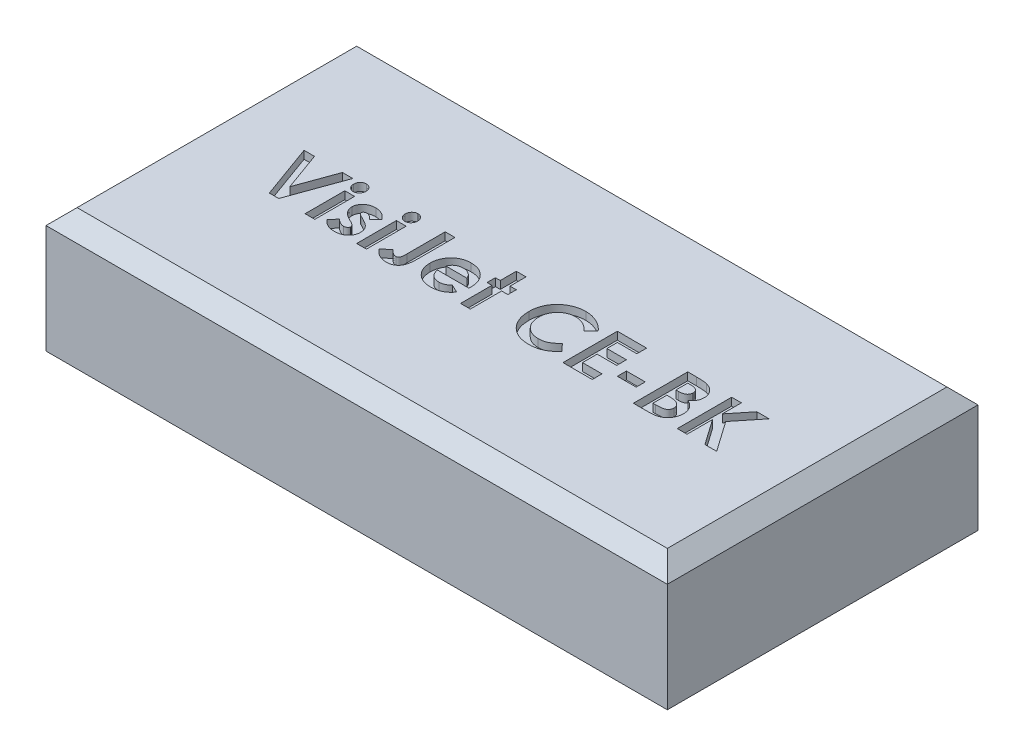
from build123d import *

# Parameters (mm, degrees)
SKETCH1_W           = 40
SKETCH1_H           = 20
BOSS_EXTRUDE1_DEPTH = 8
CHAMFER1_SIZE       = 1
SKETCH4_W           = 0.628205129
SKETCH4_H           = 2.557692308
SKETCH4_W_2         = 0.628205128
SKETCH4_W_3         = 1.211538461
SKETCH4_H_2         = 0.583333333
CUT_EXTRUDE3_DEPTH  = 0.5


with BuildPart() as part:
    # Sketch1 → Boss-Extrude1 (new body)
    with BuildSketch(Plane(origin=(0, 0, 0), x_dir=(1, 0, 0), z_dir=(0, 1, 0))):
        with Locations((0, 2.318501171)):
            Rectangle(SKETCH1_W, SKETCH1_H)
    extrude(amount=BOSS_EXTRUDE1_DEPTH)

    # Chamfer1
    chamfer1_edges = [part.edges().sort_by_distance(p)[0] for p in [
        (0, 8, 7.681498829),
        (-20, 8, -2.318501171),
        (0, 8, -12.318501171),
        (20, 8, -2.318501171),
    ]]
    chamfer(chamfer1_edges, length=CHAMFER1_SIZE)

    # Sketch4 → Cut-Extrude3 (cut)
    # profile 1 of 14: a face of its own
    with BuildSketch(Plane(origin=(0, 8, 0), x_dir=(1, 0, 0), z_dir=(0, 1, 0))):
        Polygon((-14.887820513, 3.818501171), (-14.216846955, 3.818501171), (-13.317307692, 1.332323286), (-12.415665064, 3.818501171), (-11.746794872, 3.818501171), (-13.015825321, 0.318501171), (-13.620893429, 0.318501171), align=None)
    # profile 2 of 14: a face of its own
    with BuildSketch(Plane(origin=(0, 8, 0), x_dir=(1, 0, 0), z_dir=(0, 1, 0))):
        with BuildLine():
            add(Edge.make_bspline(
                [(-11.0078125, 3.953116556), (-10.980736863, 3.951788122), (-10.927571242, 3.949179616), (-10.851404255, 3.923752479), (-10.781498398, 3.883845348), (-10.719699681, 3.829091813), (-10.668301287, 3.763706077), (-10.629031005, 3.690502399), (-10.607155167, 3.609395081), (-10.604116937, 3.553366994), (-10.602564103, 3.524731139)],
                knots=[0, 0, 0, 0, 0.989868614, 1.943702388, 2.910836514, 3.924849579, 4.949916355, 5.946401046, 6.950409252, 8, 8, 8, 8], degree=3))
            add(Edge.make_bspline(
                [(-10.602564103, 3.524731139), (-10.604061379, 3.496306314), (-10.606978893, 3.440919191), (-10.629534491, 3.360912942), (-10.6672286, 3.287744819), (-10.719043289, 3.223330183), (-10.780172027, 3.169458486), (-10.848550388, 3.128826865), (-10.923987474, 3.104814234), (-10.976328126, 3.101987671), (-11.002904647, 3.100552453)],
                knots=[0, 0, 0, 0, 1.05296456, 2.051751585, 3.055639087, 4.085634717, 5.099016424, 6.062201612, 7.016062274, 8, 8, 8, 8], degree=3))
            add(Edge.make_bspline(
                [(-11.002904647, 3.100552453), (-11.030216632, 3.101876137), (-11.083844792, 3.104475244), (-11.160636505, 3.129961874), (-11.231474728, 3.169554711), (-11.293005362, 3.225426946), (-11.344992383, 3.291277296), (-11.382547323, 3.36618522), (-11.406038867, 3.447847148), (-11.408827293, 3.504705048), (-11.41025641, 3.533845722)],
                knots=[0, 0, 0, 0, 0.989065327, 1.942068821, 2.907541208, 3.917690034, 4.939857478, 5.938239964, 6.943311734, 8, 8, 8, 8], degree=3))
            add(Edge.make_bspline(
                [(-11.41025641, 3.533845722), (-11.40870114, 3.561787876), (-11.405646036, 3.616676204), (-11.383639159, 3.695980268), (-11.345269344, 3.767953278), (-11.294241178, 3.832142067), (-11.232985262, 3.885874243), (-11.163121369, 3.924569368), (-11.087466989, 3.948946292), (-11.034638153, 3.951712114), (-11.0078125, 3.953116556)],
                knots=[0, 0, 0, 0, 1.038616768, 2.040212704, 3.031499824, 4.052181184, 5.074969369, 6.039807101, 7.004644834, 8, 8, 8, 8], degree=3))
        make_face()
    # profile 3 of 14: a face of its own
    with BuildSketch(Plane(origin=(0, 8, 0), x_dir=(1, 0, 0), z_dir=(0, 1, 0))):
        with Locations((-11.006410257, 1.597347325)):
            Rectangle(SKETCH4_W, SKETCH4_H)
    # profile 4 of 14: a face of its own
    with BuildSketch(Plane(origin=(0, 8, 0), x_dir=(1, 0, 0), z_dir=(0, 1, 0))):
        with BuildLine():
            Line((-8.538461538, 2.481461908), (-8.922676282, 2.068501171))
            add(Edge.make_bspline(
                [(-8.922676282, 2.068501171), (-8.941861965, 2.089731169), (-8.978556908, 2.130336114), (-9.03473332, 2.185689728), (-9.090073156, 2.231782937), (-9.143545162, 2.270503154), (-9.196241427, 2.300196932), (-9.247723927, 2.32156094), (-9.298017364, 2.33512313), (-9.33135398, 2.336878704), (-9.34755609, 2.33773194)],
                knots=[0, 0, 0, 0, 1.327646587, 2.539285, 3.655602211, 4.666613517, 5.598770349, 6.454635452, 7.248928967, 8, 8, 8, 8], degree=3))
            add(Edge.make_bspline(
                [(-9.34755609, 2.33773194), (-9.363950998, 2.33723228), (-9.395342146, 2.336275585), (-9.439642091, 2.328069544), (-9.478562556, 2.313863375), (-9.511496163, 2.294499043), (-9.537955605, 2.270644174), (-9.556481095, 2.243354767), (-9.568921132, 2.213479587), (-9.569973478, 2.192258092), (-9.570512821, 2.18138178)],
                knots=[0, 0, 0, 0, 1.295068245, 2.479652818, 3.543291146, 4.55379989, 5.481948265, 6.332409746, 7.145336708, 8, 8, 8, 8], degree=3))
            add(Edge.make_bspline(
                [(-9.570512821, 2.18138178), (-9.568685479, 2.164899466), (-9.564893959, 2.130700579), (-9.53885147, 2.091034972), (-9.504395376, 2.061774466), (-9.464677463, 2.034545884), (-9.410889127, 2.004101415), (-9.37008393, 1.983255198), (-9.34755609, 1.971746363)],
                knots=[0, 0, 0, 0, 0.916701701, 1.902049539, 2.5493345, 3.440293453, 4.586830489, 6, 6, 6, 6], degree=3))
            Line((-9.34755609, 1.971746363), (-9.120392628, 1.856762389))
            add(Edge.make_bspline(
                [(-9.120392628, 1.856762389), (-9.091493092, 1.842088143), (-9.035422565, 1.813617351), (-8.956592655, 1.767675903), (-8.883784094, 1.723146153), (-8.818457399, 1.677509175), (-8.76021273, 1.631557834), (-8.709463796, 1.584837732), (-8.664979678, 1.538829986), (-8.615373643, 1.477146177), (-8.56575272, 1.394988362), (-8.524384281, 1.288145952), (-8.498004131, 1.173741222), (-8.495085471, 1.094557347), (-8.493589744, 1.053977934)],
                knots=[0, 0, 0, 0, 1.076693506, 2.088987655, 3.030641824, 3.911722491, 4.735175175, 5.493635918, 6.202154166, 6.859459289, 8.120623445, 9.372284821, 10.653373066, 12, 12, 12, 12], degree=3))
            add(Edge.make_bspline(
                [(-8.493589744, 1.053977934), (-8.494490929, 1.026601336), (-8.496254788, 0.97301807), (-8.507405532, 0.89414861), (-8.527435157, 0.81915543), (-8.553794113, 0.746869538), (-8.589298837, 0.678598082), (-8.632403311, 0.614010106), (-8.6824269, 0.552257605), (-8.740692049, 0.495453011), (-8.804520546, 0.442511751), (-8.875476691, 0.39798435), (-8.950423114, 0.35883453), (-9.031339779, 0.328262007), (-9.117091324, 0.303475813), (-9.208412819, 0.286299602), (-9.30499439, 0.275490172), (-9.371130531, 0.274260174), (-9.405048077, 0.273629376)],
                knots=[0, 0, 0, 0, 0.976600749, 1.911466839, 2.833459288, 3.740827163, 4.650527853, 5.570709661, 6.506801416, 7.479409329, 8.468875524, 9.458587492, 10.461481786, 11.480119772, 12.538142914, 13.641687514, 14.790552763, 16, 16, 16, 16], degree=3))
            add(Edge.make_bspline(
                [(-9.405048077, 0.273629376), (-9.449985913, 0.275060396), (-9.538194928, 0.277869364), (-9.66701781, 0.297436227), (-9.788660809, 0.331306797), (-9.903224006, 0.378755132), (-10.011409084, 0.43921732), (-10.111671038, 0.514237659), (-10.205748001, 0.601861553), (-10.260482956, 0.669064999), (-10.288461538, 0.703417036)],
                knots=[0, 0, 0, 0, 1.056901255, 2.07460411, 3.05625841, 4.019970729, 4.984811261, 5.963335951, 6.958928997, 8, 8, 8, 8], degree=3))
            Line((-10.288461538, 0.703417036), (-9.907752404, 1.126193479))
            add(Edge.make_bspline(
                [(-9.907752404, 1.126193479), (-9.889202969, 1.106628595), (-9.852376275, 1.067785903), (-9.790301349, 1.016566561), (-9.724621682, 0.969883899), (-9.654606101, 0.930685695), (-9.584576372, 0.899034909), (-9.517388626, 0.875292392), (-9.454309088, 0.860371823), (-9.413296399, 0.858059996), (-9.393830128, 0.856962709)],
                knots=[0, 0, 0, 0, 1.087861918, 2.159761696, 3.243809206, 4.338405912, 5.394481878, 6.343674753, 7.213841449, 8, 8, 8, 8], degree=3))
            add(Edge.make_bspline(
                [(-9.393830128, 0.856962709), (-9.374374394, 0.857526161), (-9.336975103, 0.858609269), (-9.283821027, 0.869875723), (-9.23670812, 0.888816297), (-9.196754621, 0.915077883), (-9.16352237, 0.945222173), (-9.140106619, 0.979481335), (-9.124622886, 1.015809087), (-9.122741019, 1.041208069), (-9.121794872, 1.053977934)],
                knots=[0, 0, 0, 0, 1.255011871, 2.412479185, 3.488767498, 4.514443302, 5.48617286, 6.365347346, 7.178144445, 8, 8, 8, 8], degree=3))
            add(Edge.make_bspline(
                [(-9.121794872, 1.053977934), (-9.122639116, 1.06600345), (-9.124372512, 1.090694154), (-9.138095863, 1.127139399), (-9.159641794, 1.163226039), (-9.189524825, 1.199055819), (-9.228142587, 1.234338023), (-9.275356878, 1.268790052), (-9.330078462, 1.304249964), (-9.370498939, 1.325414783), (-9.391726763, 1.336530017)],
                knots=[0, 0, 0, 0, 0.704666567, 1.446816302, 2.258757648, 3.165368109, 4.175243826, 5.322435858, 6.59381024, 8, 8, 8, 8], degree=3))
            Line((-9.391726763, 1.336530017), (-9.599959936, 1.441698286))
            add(Edge.make_bspline(
                [(-9.599959936, 1.441698286), (-9.647195532, 1.467027903), (-9.737870167, 1.515651269), (-9.860428377, 1.59903001), (-9.964156208, 1.687788338), (-10.049138191, 1.781449415), (-10.116852003, 1.879750404), (-10.16408693, 1.983942869), (-10.193802014, 2.093039043), (-10.197071148, 2.167640191), (-10.198717949, 2.205219921)],
                knots=[0, 0, 0, 0, 1.255999728, 2.41104856, 3.467751088, 4.449286722, 5.368722015, 6.253902015, 7.120417131, 8, 8, 8, 8], degree=3))
            add(Edge.make_bspline(
                [(-10.198717949, 2.205219921), (-10.198146852, 2.22957557), (-10.197025697, 2.277389666), (-10.185090323, 2.34760798), (-10.167058534, 2.41510563), (-10.141613737, 2.47998981), (-10.109019397, 2.5423249), (-10.069085675, 2.601834263), (-10.021325384, 2.658409711), (-9.967267533, 2.711869002), (-9.90728865, 2.76055668), (-9.843102423, 2.803705348), (-9.774898705, 2.840459989), (-9.702117755, 2.869763404), (-9.625684659, 2.893087098), (-9.545094878, 2.908940882), (-9.460692244, 2.919023944), (-9.402974303, 2.920375189), (-9.373497596, 2.921065274)],
                knots=[0, 0, 0, 0, 0.959035663, 1.882742823, 2.798841253, 3.708806893, 4.623422363, 5.566085165, 6.527241613, 7.536786942, 8.55815439, 9.567237405, 10.580975912, 11.605536372, 12.654523293, 13.725718749, 14.838518481, 16, 16, 16, 16], degree=3))
            add(Edge.make_bspline(
                [(-9.373497596, 2.921065274), (-9.332745859, 2.919723558), (-9.251860848, 2.91706049), (-9.132571365, 2.895510926), (-9.017350099, 2.859291083), (-8.906520067, 2.809386196), (-8.801506891, 2.746669936), (-8.704619861, 2.670511216), (-8.615203278, 2.582785406), (-8.564296139, 2.515571795), (-8.538461538, 2.481461908)],
                knots=[0, 0, 0, 0, 0.996590028, 1.978055413, 2.954661574, 3.945146934, 4.945404762, 5.939399542, 6.954276554, 8, 8, 8, 8], degree=3))
        make_face()
    # profile 5 of 14: a face of its own
    with BuildSketch(Plane(origin=(0, 8, 0), x_dir=(1, 0, 0), z_dir=(0, 1, 0))):
        with BuildLine():
            add(Edge.make_bspline(
                [(-7.687299679, 3.953116556), (-7.660224043, 3.951788122), (-7.607058422, 3.949179616), (-7.530891435, 3.923752479), (-7.460985577, 3.883845348), (-7.39918686, 3.829091813), (-7.347788466, 3.763706077), (-7.308518185, 3.690502399), (-7.286642346, 3.609395081), (-7.283604116, 3.553366994), (-7.282051282, 3.524731139)],
                knots=[0, 0, 0, 0, 0.989868614, 1.943702388, 2.910836514, 3.924849579, 4.949916355, 5.946401046, 6.950409252, 8, 8, 8, 8], degree=3))
            add(Edge.make_bspline(
                [(-7.282051282, 3.524731139), (-7.283548558, 3.496306314), (-7.286466073, 3.440919191), (-7.30902167, 3.360912942), (-7.34671578, 3.287744819), (-7.398530468, 3.223330183), (-7.459659206, 3.169458486), (-7.528037567, 3.128826865), (-7.603474654, 3.104814234), (-7.655815305, 3.101987671), (-7.682391827, 3.100552453)],
                knots=[0, 0, 0, 0, 1.05296456, 2.051751585, 3.055639087, 4.085634717, 5.099016424, 6.062201612, 7.016062274, 8, 8, 8, 8], degree=3))
            add(Edge.make_bspline(
                [(-7.682391827, 3.100552453), (-7.709703811, 3.101876137), (-7.763331971, 3.104475244), (-7.840123684, 3.129961874), (-7.910961907, 3.169554711), (-7.972492542, 3.225426946), (-8.024479562, 3.291277296), (-8.062034503, 3.36618522), (-8.085526047, 3.447847148), (-8.088314473, 3.504705048), (-8.08974359, 3.533845722)],
                knots=[0, 0, 0, 0, 0.989065327, 1.942068821, 2.907541208, 3.917690034, 4.939857478, 5.938239964, 6.943311734, 8, 8, 8, 8], degree=3))
            add(Edge.make_bspline(
                [(-8.08974359, 3.533845722), (-8.08818832, 3.561787876), (-8.085133216, 3.616676204), (-8.063126339, 3.695980268), (-8.024756523, 3.767953278), (-7.973728357, 3.832142067), (-7.912472441, 3.885874243), (-7.842608549, 3.924569368), (-7.766954168, 3.948946292), (-7.714125333, 3.951712114), (-7.687299679, 3.953116556)],
                knots=[0, 0, 0, 0, 1.038616768, 2.040212704, 3.031499824, 4.052181184, 5.074969369, 6.039807101, 7.004644834, 8, 8, 8, 8], degree=3))
        make_face()
    # profile 6 of 14: a face of its own
    with BuildSketch(Plane(origin=(0, 8, 0), x_dir=(1, 0, 0), z_dir=(0, 1, 0))):
        with Locations((-7.685897436, 1.597347325)):
            Rectangle(SKETCH4_W_2, SKETCH4_H)
    # profile 7 of 14: a face of its own
    with BuildSketch(Plane(origin=(0, 8, 0), x_dir=(1, 0, 0), z_dir=(0, 1, 0))):
        with BuildLine():
            Line((-5.801282051, 3.818501171), (-5.173076923, 3.818501171))
            Line((-5.173076923, 3.818501171), (-5.173076923, 1.494983543))
            add(Edge.make_bspline(
                [(-5.173076923, 1.494983543), (-5.173307242, 1.450574837), (-5.173751021, 1.36500803), (-5.178194035, 1.241823414), (-5.184201775, 1.128881504), (-5.192853499, 1.026363272), (-5.205703678, 0.934273674), (-5.220246178, 0.852382955), (-5.236290593, 0.780357434), (-5.263393548, 0.69974967), (-5.305470098, 0.61048574), (-5.368964815, 0.514068012), (-5.44803606, 0.430297435), (-5.539100015, 0.357533007), (-5.642923963, 0.299917344), (-5.757116044, 0.258272588), (-5.881311212, 0.233393723), (-5.967331982, 0.230333232), (-6.01161859, 0.228757581)],
                knots=[0, 0, 0, 0, 1.22248561, 2.355488409, 3.392943897, 4.335991845, 5.186735882, 5.951517034, 6.625683685, 7.215700098, 8.28923535, 9.333114649, 10.380102123, 11.447198135, 12.530158036, 13.633358744, 14.781567393, 16, 16, 16, 16], degree=3))
            add(Edge.make_bspline(
                [(-6.01161859, 0.228757581), (-6.057761205, 0.230186103), (-6.14877246, 0.233003707), (-6.282249838, 0.257002456), (-6.410538284, 0.29547967), (-6.532974101, 0.351113105), (-6.651234697, 0.420801498), (-6.76317375, 0.507243167), (-6.871128394, 0.607757176), (-6.935124566, 0.684889104), (-6.967948718, 0.72445069)],
                knots=[0, 0, 0, 0, 0.990984786, 1.954608977, 2.90473533, 3.862451285, 4.837525908, 5.848096122, 6.896271184, 8, 8, 8, 8], degree=3))
            Line((-6.967948718, 0.72445069), (-6.492588141, 1.164054056))
            add(Edge.make_bspline(
                [(-6.492588141, 1.164054056), (-6.467698798, 1.135911237), (-6.421124145, 1.083248458), (-6.350937517, 1.014574901), (-6.287625396, 0.959403624), (-6.227943023, 0.919608085), (-6.171622199, 0.891556673), (-6.117451143, 0.871350452), (-6.063741264, 0.859912583), (-6.02825888, 0.857931117), (-6.010917468, 0.856962709)],
                knots=[0, 0, 0, 0, 1.529509877, 2.862124173, 3.996688592, 4.944357383, 5.774364335, 6.554177287, 7.293378699, 8, 8, 8, 8], degree=3))
            add(Edge.make_bspline(
                [(-6.010917468, 0.856962709), (-5.994132911, 0.857837997), (-5.961861726, 0.859520887), (-5.917487608, 0.878228347), (-5.880077372, 0.907599844), (-5.85544868, 0.941366192), (-5.839753685, 0.97588449), (-5.829947157, 1.009251732), (-5.820640744, 1.04925001), (-5.813184654, 1.09585928), (-5.807550819, 1.149687495), (-5.804742759, 1.210081183), (-5.801327799, 1.277366702), (-5.801297843, 1.324371477), (-5.801282051, 1.349150209)],
                knots=[0, 0, 0, 0, 1.003927327, 1.930222208, 2.840933547, 3.835773585, 4.407906147, 5.114514582, 5.922289074, 6.876303333, 7.950072246, 9.174518422, 10.510537432, 12, 12, 12, 12], degree=3))
            Line((-5.801282051, 1.349150209), (-5.801282051, 3.818501171))
        make_face()
    # profile 8 of 14: a face of its own
    with BuildSketch(Plane(origin=(0, 8, 0), x_dir=(1, 0, 0), z_dir=(0, 1, 0))):
        with BuildLine():
            Line((-1.899539263, 1.440296043), (-3.916666667, 1.440296043))
            add(Edge.make_bspline(
                [(-3.916666667, 1.440296043), (-3.912553907, 1.416858167), (-3.904472009, 1.370800891), (-3.886921881, 1.303898702), (-3.864525285, 1.240851208), (-3.837684376, 1.18157413), (-3.80685169, 1.125754094), (-3.770887917, 1.073652917), (-3.730249223, 1.025316619), (-3.685170572, 0.980955274), (-3.636403342, 0.941206548), (-3.584184036, 0.906384151), (-3.528458768, 0.877831916), (-3.469866406, 0.853765344), (-3.407969131, 0.834702181), (-3.342675845, 0.82155468), (-3.274159632, 0.813788403), (-3.227484294, 0.8126651), (-3.203625801, 0.812090915)],
                knots=[0, 0, 0, 0, 1.091296461, 2.144483647, 3.168565212, 4.157007626, 5.126487748, 6.090021542, 7.05641414, 8.019231907, 8.98705074, 9.938580405, 10.892824166, 11.854447369, 12.841318655, 13.858982407, 14.905600794, 16, 16, 16, 16], degree=3))
            add(Edge.make_bspline(
                [(-3.203625801, 0.812090915), (-3.174826981, 0.812851231), (-3.118113623, 0.814348519), (-3.035028131, 0.827627234), (-2.954672357, 0.847684151), (-2.877806751, 0.877510469), (-2.803540944, 0.914638993), (-2.73309758, 0.960896564), (-2.66525734, 1.014931387), (-2.623866799, 1.056581407), (-2.602764423, 1.077816075)],
                knots=[0, 0, 0, 0, 1.021034703, 2.010718019, 2.977989445, 3.954245119, 4.929443971, 5.918328161, 6.938689359, 8, 8, 8, 8], degree=3))
            Line((-2.602764423, 1.077816075), (-2.076923077, 0.827515594))
            add(Edge.make_bspline(
                [(-2.076923077, 0.827515594), (-2.093478885, 0.804638008), (-2.126283609, 0.759306914), (-2.179836221, 0.695514356), (-2.235721782, 0.635993312), (-2.29398197, 0.581135261), (-2.354690675, 0.531096525), (-2.41767902, 0.485267543), (-2.483867552, 0.444878805), (-2.551932846, 0.407976328), (-2.623281936, 0.376340006), (-2.697717368, 0.349361667), (-2.774923865, 0.324973478), (-2.85587638, 0.306391014), (-2.939900822, 0.291681287), (-3.027198192, 0.281235432), (-3.117756987, 0.274783528), (-3.179309272, 0.274018663), (-3.210637019, 0.273629376)],
                knots=[0, 0, 0, 0, 1.028154879, 2.037251081, 3.030720504, 4.000128189, 4.949298328, 5.894184978, 6.834267904, 7.770992897, 8.712077017, 9.673380525, 10.653304757, 11.658697181, 12.695551717, 13.758623199, 14.859225354, 16, 16, 16, 16], degree=3))
            add(Edge.make_bspline(
                [(-3.210637019, 0.273629376), (-3.258834244, 0.274611973), (-3.353225731, 0.276536331), (-3.491290345, 0.294397131), (-3.622413434, 0.324012264), (-3.746965244, 0.364269488), (-3.86440738, 0.417421635), (-3.974797965, 0.48243112), (-4.079239957, 0.558051581), (-4.174542071, 0.645870091), (-4.261365109, 0.741455317), (-4.337625067, 0.844107324), (-4.401438314, 0.953108919), (-4.453843035, 1.067738708), (-4.494573806, 1.188290097), (-4.523938328, 1.314815693), (-4.541939133, 1.447255065), (-4.543883309, 1.537461062), (-4.544871795, 1.583324889)],
                knots=[0, 0, 0, 0, 1.103565453, 2.161269334, 3.182010356, 4.179077853, 5.15417608, 6.128274628, 7.109042802, 8.101804412, 9.090965879, 10.063106201, 11.02526161, 11.978650795, 12.945248442, 13.93468508, 14.949922959, 16, 16, 16, 16], degree=3))
            add(Edge.make_bspline(
                [(-4.544871795, 1.583324889), (-4.54387358, 1.630354174), (-4.541909637, 1.722882182), (-4.524093315, 1.85837964), (-4.494492623, 1.987662542), (-4.453642706, 2.110908923), (-4.40203297, 2.228504247), (-4.337407809, 2.339419694), (-4.261402952, 2.444041412), (-4.174892693, 2.54187997), (-4.07918685, 2.630189957), (-3.977490349, 2.708891804), (-3.868660527, 2.774471407), (-3.753928342, 2.827459686), (-3.634027663, 2.870511324), (-3.507572605, 2.899158594), (-3.375525299, 2.918393521), (-3.285260669, 2.920164938), (-3.239383013, 2.921065274)],
                knots=[0, 0, 0, 0, 1.079208495, 2.12329425, 3.130605359, 4.119693003, 5.099659317, 6.073216462, 7.060498243, 8.06384408, 9.066070512, 10.045757761, 11.010926815, 11.975797609, 12.942977511, 13.929384301, 14.947594487, 16, 16, 16, 16], degree=3))
            add(Edge.make_bspline(
                [(-3.239383013, 2.921065274), (-3.19095489, 2.920067433), (-3.095871263, 2.918108276), (-2.956845072, 2.900392501), (-2.824851342, 2.870596779), (-2.699327704, 2.830687652), (-2.581877149, 2.776192825), (-2.469918929, 2.712783121), (-2.366138439, 2.635528066), (-2.269429489, 2.548139312), (-2.182129897, 2.451184518), (-2.105820381, 2.345861916), (-2.040890375, 2.233199394), (-1.98826396, 2.112740081), (-1.947575013, 1.984845607), (-1.918183308, 1.849682068), (-1.900319807, 1.706735368), (-1.898411808, 1.60885157), (-1.897435897, 1.558785626)],
                knots=[0, 0, 0, 0, 1.080001299, 2.120471247, 3.119684163, 4.095710327, 5.052285597, 6.002875087, 6.961153713, 7.931888285, 8.906493152, 9.865905668, 10.82813294, 11.801621613, 12.7925306, 13.817193356, 14.883530496, 16, 16, 16, 16], degree=3))
            Line((-1.897435897, 1.558785626), (-1.899539263, 1.440296043))
        make_face()
        with BuildLine():
            add(Edge.make_bspline(
                [(-2.525641026, 1.933885786), (-2.537495641, 1.96587659), (-2.561065703, 2.029482642), (-2.614309494, 2.117243473), (-2.684962301, 2.193247917), (-2.767136584, 2.260535254), (-2.861025847, 2.315149859), (-2.963671477, 2.354692608), (-3.073776051, 2.378402936), (-3.149522064, 2.381183741), (-3.188201122, 2.382603735)],
                knots=[0, 0, 0, 0, 0.954238005, 1.897273737, 2.851915805, 3.847685534, 4.862635127, 5.880135777, 6.917509367, 8, 8, 8, 8], degree=3))
            add(Edge.make_bspline(
                [(-3.188201122, 2.382603735), (-3.23044495, 2.381239658), (-3.313022839, 2.37857317), (-3.43213582, 2.350214097), (-3.544492115, 2.307889028), (-3.610731019, 2.264250982), (-3.643930288, 2.242379376)],
                knots=[0, 0, 0, 0, 1.044195649, 2.041185066, 3.018232172, 4, 4, 4, 4], degree=3))
            add(Edge.make_bspline(
                [(-3.643930288, 2.242379376), (-3.664644153, 2.225721482), (-3.708805053, 2.190207702), (-3.766156942, 2.119361084), (-3.822649029, 2.033581734), (-3.854767895, 1.968426257), (-3.871794872, 1.933885786)],
                knots=[0, 0, 0, 0, 0.82159062, 1.751589201, 2.808063854, 4, 4, 4, 4], degree=3))
            Line((-3.871794872, 1.933885786), (-2.525641026, 1.933885786))
        make_face(mode=Mode.SUBTRACT)
    # profile 9 of 14: a face of its own
    with BuildSketch(Plane(origin=(0, 8, 0), x_dir=(1, 0, 0), z_dir=(0, 1, 0))):
        Polygon((-1.314102564, 3.908244761), (-0.685897436, 3.908244761), (-0.685897436, 2.876193479), (-0.282051282, 2.876193479), (-0.282051282, 2.33773194), (-0.685897436, 2.33773194), (-0.685897436, 0.318501171), (-1.314102564, 0.318501171), (-1.314102564, 2.33773194), (-1.628205128, 2.33773194), (-1.628205128, 2.876193479), (-1.314102564, 2.876193479), align=None)
    # profile 10 of 14: a face of its own
    with BuildSketch(Plane(origin=(0, 8, 0), x_dir=(1, 0, 0), z_dir=(0, 1, 0))):
        with BuildLine():
            Line((4.653846154, 3.211329697), (4.193209135, 2.771025209))
            add(Edge.make_bspline(
                [(4.193209135, 2.771025209), (4.15413415, 2.811428809), (4.077808463, 2.890349697), (3.954819058, 2.994833998), (3.826914555, 3.081907526), (3.696583081, 3.155240296), (3.56148035, 3.210721764), (3.423168517, 3.251152043), (3.280764422, 3.275800857), (3.184390808, 3.278621117), (3.135917468, 3.280039632)],
                knots=[0, 0, 0, 0, 1.115251505, 2.178435587, 3.19620269, 4.182487026, 5.141301733, 6.088180966, 7.038406374, 8, 8, 8, 8], degree=3))
            add(Edge.make_bspline(
                [(3.135917468, 3.280039632), (3.095436339, 3.278918956), (3.01555129, 3.276707424), (2.898259105, 3.260494714), (2.786063069, 3.232924295), (2.678579115, 3.19492715), (2.576123522, 3.145760861), (2.478481477, 3.085463482), (2.385893713, 3.014579584), (2.299583261, 2.933475923), (2.220629493, 2.844864078), (2.150868811, 2.750315452), (2.09243305, 2.650046649), (2.044475772, 2.545073118), (2.007118906, 2.434908989), (1.98044141, 2.31962843), (1.965011859, 2.199094151), (1.962708896, 2.117155846), (1.961538462, 2.075512389)],
                knots=[0, 0, 0, 0, 1.035432265, 2.043311493, 3.022114605, 3.98653278, 4.95457646, 5.923598177, 6.917315552, 7.932509744, 8.948865224, 9.949768934, 10.933144597, 11.912367597, 12.897413939, 13.903909035, 14.934704909, 16, 16, 16, 16], degree=3))
            add(Edge.make_bspline(
                [(1.961538462, 2.075512389), (1.961875767, 2.046284097), (1.962540604, 1.988674533), (1.969818415, 1.903453999), (1.981537407, 1.820769935), (1.998497693, 1.740747583), (2.019706696, 1.663317596), (2.044589687, 1.587811991), (2.075805032, 1.515274083), (2.110454537, 1.444861392), (2.150751511, 1.378495218), (2.194199083, 1.315209562), (2.241310882, 1.255314646), (2.292392052, 1.199055321), (2.348161499, 1.147310795), (2.407177788, 1.098525048), (2.470436443, 1.053919353), (2.53662342, 1.012374281), (2.606310492, 0.976283723), (2.677606887, 0.94359265), (2.751593602, 0.917042638), (2.827369803, 0.895640906), (2.904664695, 0.87744193), (2.984234292, 0.866236261), (3.065388826, 0.857750339), (3.12023567, 0.857226383), (3.147836538, 0.856962709)],
                knots=[0, 0, 0, 0, 1.103660481, 2.175337485, 3.227646561, 4.255952547, 5.262355991, 6.258840057, 7.255597736, 8.242457506, 9.22035537, 10.185017736, 11.140346927, 12.096287581, 13.051739095, 14.01125915, 14.986044842, 15.97314143, 16.960198552, 17.947847494, 18.933482797, 19.925264591, 20.920966487, 21.929612487, 22.958107872, 24, 24, 24, 24], degree=3))
            add(Edge.make_bspline(
                [(3.147836538, 0.856962709), (3.194652355, 0.858316871), (3.286633262, 0.860977447), (3.421628467, 0.881782774), (3.55026545, 0.91600636), (3.653045783, 0.956422426), (3.733571459, 0.996333816), (3.794874466, 1.033249886), (3.858266553, 1.074544563), (3.922694832, 1.121776354), (3.988883993, 1.174378458), (4.055665645, 1.233502959), (4.12474941, 1.297202972), (4.1700055, 1.342666923), (4.193209135, 1.365977132)],
                knots=[0, 0, 0, 0, 1.404581149, 2.759636711, 4.088442092, 5.392261763, 6.066678138, 6.783632037, 7.538459478, 8.336747902, 9.180226004, 10.074962426, 11.012997595, 12, 12, 12, 12], degree=3))
            Line((4.193209135, 1.365977132), (4.639823718, 0.896926652))
            add(Edge.make_bspline(
                [(4.639823718, 0.896926652), (4.608429117, 0.86661615), (4.547153569, 0.807456532), (4.454721106, 0.723455396), (4.362404973, 0.647971036), (4.272435336, 0.578263703), (4.183338398, 0.516364139), (4.095123606, 0.462210526), (4.008789593, 0.414433239), (3.922543603, 0.37383802), (3.83584897, 0.339368462), (3.746650381, 0.309692436), (3.654675147, 0.284587585), (3.559361526, 0.264331267), (3.461598544, 0.248088435), (3.360471271, 0.237124617), (3.256620902, 0.229754008), (3.186177588, 0.229091697), (3.150641026, 0.228757581)],
                knots=[0, 0, 0, 0, 1.244526981, 2.429050516, 3.560637417, 4.644440555, 5.67424972, 6.652764056, 7.595344123, 8.486817594, 9.369275933, 10.254498637, 11.166417451, 12.086725134, 13.032340136, 13.991389299, 14.986715468, 16, 16, 16, 16], degree=3))
            add(Edge.make_bspline(
                [(3.150641026, 0.228757581), (3.085364762, 0.230421603), (2.957637258, 0.233677632), (2.770455931, 0.257802601), (2.592638695, 0.298247686), (2.423752955, 0.355448193), (2.26385241, 0.428519159), (2.11297797, 0.518100732), (1.97137281, 0.623954908), (1.840180821, 0.744840974), (1.721511423, 0.878349485), (1.616621418, 1.021700999), (1.529856402, 1.175600037), (1.457813539, 1.337773017), (1.401476968, 1.508959999), (1.361825573, 1.689346153), (1.337372847, 1.878757307), (1.334697684, 2.008129492), (1.333333333, 2.074110145)],
                knots=[0, 0, 0, 0, 1.078019885, 2.10938526, 3.111377082, 4.085535484, 5.04941344, 6.010039228, 6.978205633, 7.964457913, 8.951525778, 9.924444315, 10.892603023, 11.863865945, 12.85144698, 13.863884204, 14.910567087, 16, 16, 16, 16], degree=3))
            add(Edge.make_bspline(
                [(1.333333333, 2.074110145), (1.333909842, 2.117142165), (1.33505234, 2.202421109), (1.347060108, 2.328043904), (1.363799634, 2.450503658), (1.39035537, 2.568528834), (1.42236569, 2.683709448), (1.462174729, 2.794793622), (1.509718906, 2.902100622), (1.56346576, 3.005810088), (1.624269039, 3.105242611), (1.692192976, 3.199543908), (1.765488945, 3.28944197), (1.845918128, 3.37374413), (1.932311784, 3.453190578), (2.02505997, 3.527350779), (2.123604853, 3.597288274), (2.228213156, 3.661199544), (2.33685262, 3.719010685), (2.448153013, 3.77000258), (2.561840886, 3.812620062), (2.677435554, 3.847969692), (2.795425403, 3.87435569), (2.914968253, 3.89432904), (3.03708127, 3.90549427), (3.119069581, 3.90732209), (3.160456731, 3.908244761)],
                knots=[0, 0, 0, 0, 1.071919942, 2.124283339, 3.142214191, 4.149696895, 5.136002878, 6.119640489, 7.086990633, 8.058538607, 9.028339693, 9.988281803, 10.952401235, 11.916291999, 12.888973767, 13.874849856, 14.873389453, 15.898127285, 16.927174885, 17.938320013, 18.946391617, 19.950418109, 20.947802303, 21.956882652, 22.968648068, 24, 24, 24, 24], degree=3))
            add(Edge.make_bspline(
                [(3.160456731, 3.908244761), (3.195764213, 3.907715863), (3.266012078, 3.906663566), (3.370622937, 3.897891525), (3.474397167, 3.884115124), (3.576963225, 3.863329469), (3.679054768, 3.83865427), (3.779330199, 3.8063455), (3.879371417, 3.770331288), (3.977609424, 3.72728365), (4.074181345, 3.680293266), (4.166824832, 3.626980968), (4.25709536, 3.570627536), (4.342992589, 3.507897727), (4.426125557, 3.441066868), (4.506059557, 3.369823155), (4.58209312, 3.292978747), (4.629807562, 3.238683637), (4.653846154, 3.211329697)],
                knots=[0, 0, 0, 0, 0.996412454, 1.982464992, 2.961075852, 3.949442424, 4.934965278, 5.923860011, 6.921385422, 7.934793307, 8.949617135, 9.951082467, 10.950285876, 11.951772932, 12.951063433, 13.960125323, 14.972308753, 16, 16, 16, 16], degree=3))
        make_face()
    # profile 11 of 14: a face of its own
    with BuildSketch(Plane(origin=(0, 8, 0), x_dir=(1, 0, 0), z_dir=(0, 1, 0))):
        Polygon((5.282051282, 3.818501171), (7.166666667, 3.818501171), (7.166666667, 3.190296043), (5.91025641, 3.190296043), (5.91025641, 2.51721912), (7.166666667, 2.51721912), (7.166666667, 1.889013991), (5.91025641, 1.889013991), (5.91025641, 0.946706299), (7.166666667, 0.946706299), (7.166666667, 0.318501171), (5.282051282, 0.318501171), align=None)
    # profile 12 of 14: a face of its own
    with BuildSketch(Plane(origin=(0, 8, 0), x_dir=(1, 0, 0), z_dir=(0, 1, 0))):
        with Locations((8.400641026, 1.597347325)):
            Rectangle(SKETCH4_W_3, SKETCH4_H_2)
    # profile 13 of 14: a face of its own
    with BuildSketch(Plane(origin=(0, 8, 0), x_dir=(1, 0, 0), z_dir=(0, 1, 0))):
        with BuildLine():
            Line((9.814102564, 0.318501171), (9.814102564, 3.818501171))
            Line((9.814102564, 3.818501171), (10.375, 3.818501171))
            add(Edge.make_bspline(
                [(10.375, 3.818501171), (10.414266328, 3.818505652), (10.490245927, 3.818514323), (10.599864661, 3.814664873), (10.701526778, 3.809685178), (10.794908752, 3.804114058), (10.880169524, 3.794513904), (10.957179442, 3.784396391), (11.026092371, 3.772195293), (11.068697491, 3.76125053), (11.088741987, 3.756101331)],
                knots=[0, 0, 0, 0, 1.311965854, 2.538629056, 3.664479157, 4.713267157, 5.663616078, 6.530575999, 7.308677837, 8, 8, 8, 8], degree=3))
            add(Edge.make_bspline(
                [(11.088741987, 3.756101331), (11.115062446, 3.748838294), (11.166711635, 3.734585883), (11.240689756, 3.705802524), (11.310868323, 3.673807779), (11.37716165, 3.637307759), (11.43916267, 3.595861807), (11.496635757, 3.549140995), (11.550820465, 3.499020694), (11.599792817, 3.444104065), (11.644055754, 3.386074475), (11.682512311, 3.324947127), (11.715926129, 3.2616567), (11.742665937, 3.195406725), (11.762813879, 3.126502301), (11.77755, 3.055237661), (11.787101002, 2.981387306), (11.788003446, 2.931144495), (11.788461538, 2.905640594)],
                knots=[0, 0, 0, 0, 1.099996261, 2.158545794, 3.195537121, 4.207578794, 5.205712374, 6.197378256, 7.190519799, 8.17788031, 9.159561366, 10.129234751, 11.085776129, 12.040971148, 13.00380137, 13.975669004, 14.972423361, 16, 16, 16, 16], degree=3))
            add(Edge.make_bspline(
                [(11.788461538, 2.905640594), (11.787263763, 2.872874775), (11.784906088, 2.808379286), (11.769845104, 2.713647082), (11.741603412, 2.624111532), (11.704649845, 2.538122532), (11.654404547, 2.456000819), (11.590602737, 2.377785442), (11.514277793, 2.30106803), (11.455732348, 2.255081117), (11.425280449, 2.231161427)],
                knots=[0, 0, 0, 0, 0.986156485, 1.941127874, 2.875419072, 3.804401753, 4.751181392, 5.761612777, 6.835722519, 8, 8, 8, 8], degree=3))
            add(Edge.make_bspline(
                [(11.425280449, 2.231161427), (11.449957207, 2.218564156), (11.498341504, 2.193864392), (11.56703299, 2.153265354), (11.630633808, 2.110083128), (11.689429125, 2.065186558), (11.742185641, 2.016672412), (11.791081762, 1.967336144), (11.833705206, 1.914350989), (11.871820375, 1.85960544), (11.90494946, 1.802306775), (11.93380124, 1.742551757), (11.958171304, 1.680136252), (11.978808504, 1.615377904), (11.994199733, 1.548053973), (12.004235142, 1.478140383), (12.011918879, 1.405875574), (12.012516601, 1.35665059), (12.012820513, 1.331622165)],
                knots=[0, 0, 0, 0, 1.164658916, 2.283573913, 3.35186032, 4.395461096, 5.390182219, 6.362969632, 7.312859996, 8.245001507, 9.165155236, 10.092416118, 11.032087915, 11.979892451, 12.947605196, 13.931445124, 14.948243989, 16, 16, 16, 16], degree=3))
            add(Edge.make_bspline(
                [(12.012820513, 1.331622165), (12.010848328, 1.283819302), (12.006956231, 1.189480545), (11.97849911, 1.050969584), (11.929163505, 0.91964863), (11.86291596, 0.796039608), (11.781286239, 0.683720797), (11.687435469, 0.585330494), (11.582308511, 0.502045287), (11.485316186, 0.445834233), (11.401425463, 0.40811136), (11.331940345, 0.384788701), (11.257314801, 0.363182624), (11.17618187, 0.348010391), (11.090012382, 0.334123096), (10.997966178, 0.325548791), (10.900215293, 0.319738197), (10.833075759, 0.318921849), (10.798477564, 0.318501171)],
                knots=[0, 0, 0, 0, 1.284142165, 2.534249414, 3.780121997, 5.041676246, 6.291546858, 7.49970053, 8.684500223, 9.883330709, 10.50184324, 11.153274765, 11.851151195, 12.587658647, 13.369265475, 14.195992086, 15.070362669, 16, 16, 16, 16], degree=3))
            Line((10.798477564, 0.318501171), (9.814102564, 0.318501171))
        make_face()
        with BuildLine():
            Line((10.442307692, 3.190296043), (10.442307692, 2.42747553))
            Line((10.442307692, 2.42747553), (10.609174679, 2.42747553))
            add(Edge.make_bspline(
                [(10.609174679, 2.42747553), (10.631853402, 2.427673297), (10.675633304, 2.428055074), (10.738868728, 2.432972233), (10.797667461, 2.441361212), (10.851806491, 2.453065948), (10.901790142, 2.467929257), (10.947299106, 2.485813017), (10.988133287, 2.507633149), (11.035573161, 2.540135198), (11.085720529, 2.587963419), (11.129864693, 2.657061193), (11.155865311, 2.736523371), (11.158761078, 2.792566252), (11.16025641, 2.821505979)],
                knots=[0, 0, 0, 0, 1.065314748, 2.056525647, 2.977365736, 3.853934255, 4.656397591, 5.425096493, 6.14721249, 6.826394842, 8.123232004, 9.372140726, 10.643011755, 12, 12, 12, 12], degree=3))
            add(Edge.make_bspline(
                [(11.16025641, 2.821505979), (11.159059871, 2.848612841), (11.15674641, 2.901022871), (11.130567131, 2.97461122), (11.089905535, 3.039825558), (11.041898805, 3.084459439), (10.996691141, 3.114943064), (10.957981565, 3.135015233), (10.915494898, 3.152983634), (10.868408645, 3.166722711), (10.816991693, 3.17703203), (10.761493804, 3.184602991), (10.701819224, 3.189756109), (10.660601865, 3.190112204), (10.639322917, 3.190296043)],
                knots=[0, 0, 0, 0, 1.347982417, 2.606269829, 3.849316587, 5.153353503, 5.842674298, 6.568177932, 7.326619318, 8.142485038, 9.012069166, 9.942760135, 10.937925643, 12, 12, 12, 12], degree=3))
            Line((10.639322917, 3.190296043), (10.442307692, 3.190296043))
        make_face(mode=Mode.SUBTRACT)
        with BuildLine():
            Line((10.442307692, 1.844142197), (10.442307692, 0.946706299))
            Line((10.442307692, 0.946706299), (10.623197115, 0.946706299))
            add(Edge.make_bspline(
                [(10.623197115, 0.946706299), (10.658959185, 0.946910607), (10.727716225, 0.947303413), (10.826210564, 0.952049449), (10.915766542, 0.960603342), (10.996146869, 0.971282188), (11.067474663, 0.985750355), (11.129508818, 1.004144774), (11.183100054, 1.02438184), (11.227927034, 1.049377018), (11.264548108, 1.078465208), (11.297594788, 1.108194036), (11.324538992, 1.142489048), (11.345857749, 1.179878054), (11.364309095, 1.219432285), (11.375437645, 1.262696318), (11.383910531, 1.308387911), (11.384376817, 1.339991798), (11.384615385, 1.356161427)],
                knots=[0, 0, 0, 0, 1.753078804, 3.370512758, 4.83203934, 6.162291463, 7.344201807, 8.395507345, 9.331626367, 10.147333109, 10.898971645, 11.62040215, 12.321813352, 13.025280112, 13.727906689, 14.453419512, 15.208716525, 16, 16, 16, 16], degree=3))
            add(Edge.make_bspline(
                [(11.384615385, 1.356161427), (11.384089274, 1.374651653), (11.383064553, 1.410665639), (11.374695643, 1.463303922), (11.3594866, 1.512445252), (11.340330068, 1.559346239), (11.313672735, 1.602327663), (11.281991407, 1.642876951), (11.243712275, 1.679620976), (11.200665157, 1.714782156), (11.150454956, 1.745567673), (11.093058115, 1.772279563), (11.028162823, 1.79458835), (10.955568059, 1.81235062), (10.875592074, 1.827425213), (10.787651131, 1.83642641), (10.692477632, 1.843120995), (10.626482779, 1.843794061), (10.592347756, 1.844142197)],
                knots=[0, 0, 0, 0, 0.845221588, 1.646264278, 2.427170338, 3.19324141, 3.95557735, 4.731569926, 5.540061037, 6.376114724, 7.268642756, 8.224665384, 9.265483498, 10.400594375, 11.639216012, 12.983232105, 14.439614077, 16, 16, 16, 16], degree=3))
            Line((10.592347756, 1.844142197), (10.442307692, 1.844142197))
        make_face(mode=Mode.SUBTRACT)
    # profile 14 of 14: a face of its own
    with BuildSketch(Plane(origin=(0, 8, 0), x_dir=(1, 0, 0), z_dir=(0, 1, 0))):
        Polygon((12.641025641, 3.818501171), (13.269230769, 3.818501171), (13.269230769, 2.586630177), (14.262019231, 3.818501171), (15.054987981, 3.818501171), (13.807692308, 2.270424248), (15.176282051, 0.318501171), (14.419771635, 0.318501171), (13.269230769, 1.959827293), (13.269230769, 0.318501171), (12.641025641, 0.318501171), align=None)
    extrude(amount=-CUT_EXTRUDE3_DEPTH, mode=Mode.SUBTRACT)


solid = part.part
